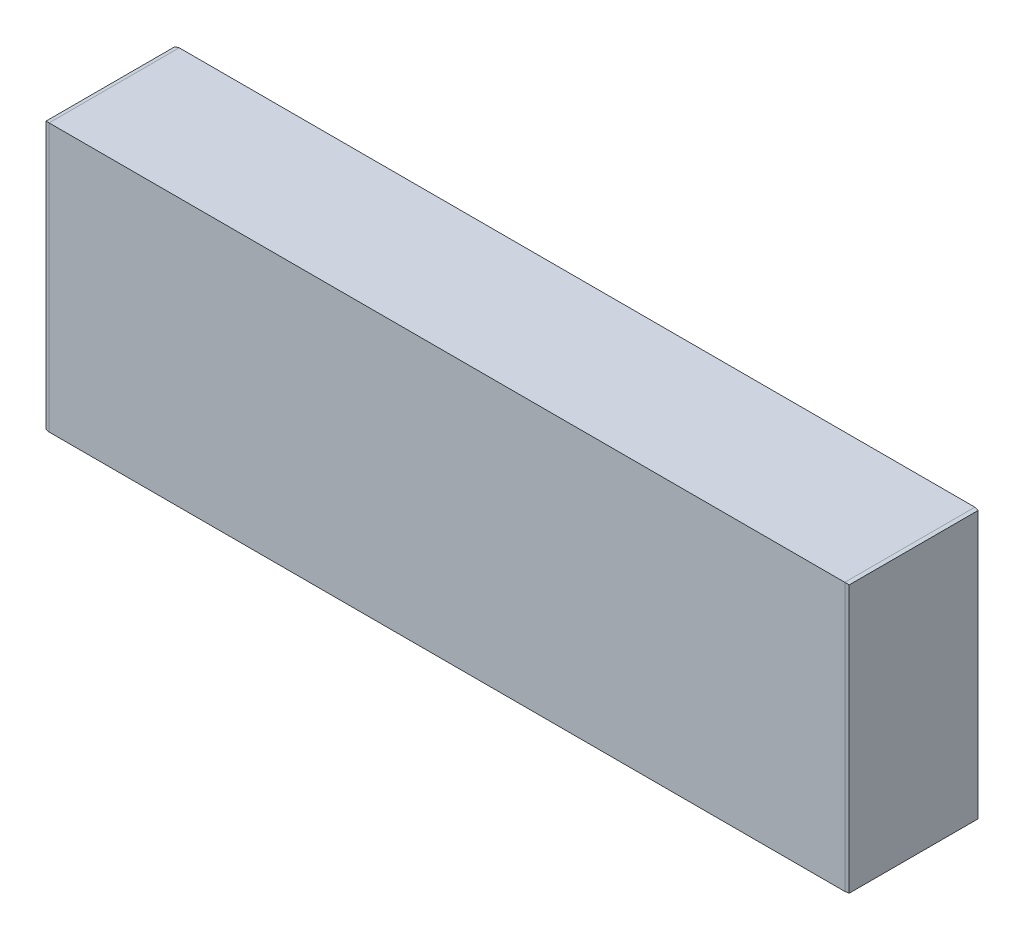
from build123d import *
from OCP.BRepFilletAPI import BRepFilletAPI_MakeChamfer

# Parameters (mm, degrees)
SKETCH1_W           = 213
SKETCH1_H           = 71
BOSS_EXTRUDE1_DEPTH = 34.5
CHAMFER1_SIZE       = 1
CHAMFER1_SIZE2      = 0.176326981
CHAMFER2_SIZE       = 1
CHAMFER2_SIZE2      = 0.176326981
SKETCH3_W           = 24.147346038
SKETCH3_H           = 16.197572193
SKETCH3_W_2         = 4
SKETCH3_H_2         = 13.380603116
CUT_EXTRUDE2_DEPTH  = 1
SKETCH4_W           = 6
SKETCH4_H           = 1
CUT_EXTRUDE3_DEPTH  = 1


with BuildPart() as part:
    # Sketch1 → Boss-Extrude1 (new body)
    with BuildSketch(Plane.XY):
        with Locations((61.169898141, -8.554853616)):
            Rectangle(SKETCH1_W, SKETCH1_H)
    extrude(amount=BOSS_EXTRUDE1_DEPTH)

    # Chamfer1: one chamfer whose edges measure the first distance from different faces: ONE call of the kernel's chamfer builder (chamfer() names one face for all edges)
    chamfer1_edges_1 = [part.edges().sort_by_distance(p)[0] for p in [
        (-45.330101859, -8.554853616, 34.5),
    ]]
    chamfer1_side_1 = [part.faces().sort_by_distance(p)[0] for p in [
        (61.169898141, -8.554853616, 34.5),
    ]]
    chamfer1_edges_2 = [part.edges().sort_by_distance(p)[0] for p in [
        (-45.330101859, -8.554853616, 0),
    ]]
    chamfer1_side_2 = [part.faces().sort_by_distance(p)[0] for p in [
        (61.169898141, -8.554853616, 0),
    ]]
    chamfer1_edges_3 = [part.edges().sort_by_distance(p)[0] for p in [
        (-45.330101859, 26.945146384, 17.25),
    ]]
    chamfer1_side_3 = [part.faces().sort_by_distance(p)[0] for p in [
        (61.169898141, 26.945146384, 17.25),
    ]]
    chamfer1 = BRepFilletAPI_MakeChamfer(part.part.solid().wrapped)
    for e in chamfer1_edges_1:
        chamfer1.Add(CHAMFER1_SIZE, CHAMFER1_SIZE2, e.wrapped, chamfer1_side_1[0].wrapped)  # the first distance lies on this face
    for e in chamfer1_edges_2:
        chamfer1.Add(CHAMFER1_SIZE, CHAMFER1_SIZE2, e.wrapped, chamfer1_side_2[0].wrapped)  # the first distance lies on this face
    for e in chamfer1_edges_3:
        chamfer1.Add(CHAMFER1_SIZE, CHAMFER1_SIZE2, e.wrapped, chamfer1_side_3[0].wrapped)  # the first distance lies on this face
    add(Compound.cast(chamfer1.Shape()), mode=Mode.REPLACE)

    # Chamfer2: one chamfer whose edges measure the first distance from different faces: ONE call of the kernel's chamfer builder (chamfer() names one face for all edges)
    chamfer2_edges_1 = [part.edges().sort_by_distance(p)[0] for p in [
        (167.669898141, -8.554853616, 0),
    ]]
    chamfer2_side_1 = [part.faces().sort_by_distance(p)[0] for p in [
        (61.669898141, -8.554853616, 0),
    ]]
    chamfer2_edges_2 = [part.edges().sort_by_distance(p)[0] for p in [
        (167.669898141, -8.554853616, 34.5),
    ]]
    chamfer2_side_2 = [part.faces().sort_by_distance(p)[0] for p in [
        (61.669898141, -8.554853616, 34.5),
    ]]
    chamfer2_edges_3 = [part.edges().sort_by_distance(p)[0] for p in [
        (167.669898141, 26.945146384, 17.25),
    ]]
    chamfer2_side_3 = [part.faces().sort_by_distance(p)[0] for p in [
        (61.669898141, 26.945146384, 17.25),
    ]]
    chamfer2 = BRepFilletAPI_MakeChamfer(part.part.solid().wrapped)
    for e in chamfer2_edges_1:
        chamfer2.Add(CHAMFER2_SIZE, CHAMFER2_SIZE2, e.wrapped, chamfer2_side_1[0].wrapped)  # the first distance lies on this face
    for e in chamfer2_edges_2:
        chamfer2.Add(CHAMFER2_SIZE, CHAMFER2_SIZE2, e.wrapped, chamfer2_side_2[0].wrapped)  # the first distance lies on this face
    for e in chamfer2_edges_3:
        chamfer2.Add(CHAMFER2_SIZE, CHAMFER2_SIZE2, e.wrapped, chamfer2_side_3[0].wrapped)  # the first distance lies on this face
    add(Compound.cast(chamfer2.Shape()), mode=Mode.REPLACE)

    # Sketch3 → Cut-Extrude2 (cut)
    with BuildSketch(Plane.ZY.offset(45.330101859)):
        with Locations((17.25, -25.758486194)):
            Rectangle(SKETCH3_W, SKETCH3_H)
        with Locations((8.805796188, -25.859092232)):
            Rectangle(SKETCH3_W_2, SKETCH3_H_2, mode=Mode.SUBTRACT)
        with Locations((14.435265396, -25.859092232)):
            Rectangle(SKETCH3_W_2, SKETCH3_H_2, mode=Mode.SUBTRACT)
        with Locations((20.064734604, -25.859092232)):
            Rectangle(SKETCH3_W_2, SKETCH3_H_2, mode=Mode.SUBTRACT)
        with Locations((25.694203812, -25.859092232)):
            Rectangle(SKETCH3_W_2, SKETCH3_H_2, mode=Mode.SUBTRACT)
    extrude(amount=-CUT_EXTRUDE2_DEPTH, mode=Mode.SUBTRACT)

    # Sketch4 → Cut-Extrude3 (cut)
    with BuildSketch(Plane.ZY.offset(45.330101859)):
        Polygon((8.176326981, -35.85727229), (9.176326981, -35.85727229), (9.176326981, -38.35727229), (11.676326981, -38.35727229), (11.676326981, -39.35727229), (9.176326981, -39.35727229), (9.176326981, -41.85727229), (8.176326981, -41.85727229), (8.176326981, -39.35727229), (5.676326981, -39.35727229), (5.676326981, -38.35727229), (8.176326981, -38.35727229), align=None)
        with Locations((25.720428724, -38.85727229)):
            Rectangle(SKETCH4_W, SKETCH4_H)
    extrude(amount=-CUT_EXTRUDE3_DEPTH, mode=Mode.SUBTRACT)


solid = part.part
